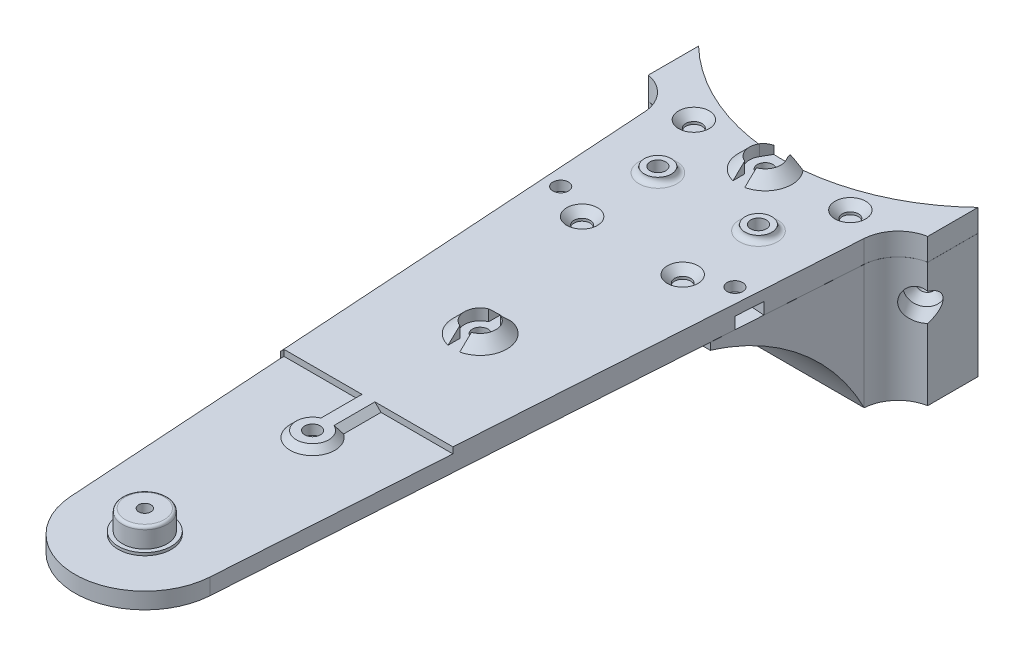
from build123d import *

# Parameters (mm, degrees)
BOSS_EXTRUDE1_DEPTH                            = 4
BOSS_EXTRUDE2_DEPTH                            = 22.2378
FILLET2_R                                      = 40
CUT_EXTRUDE3_DEPTH                             = 1.09
CUT_EXTRUDE4_DEPTH                             = 166.90892004
SKETCH11_R                                     = 161
CUT_EXTRUDE5_DEPTH                             = 0.01
SKETCH12_R                                     = 1.4
CUT_EXTRUDE6_DEPTH                             = 8.25
CUT_EXTRUDE7_DEPTH                             = 8.5
CUT_EXTRUDE8_DEPTH                             = 2.5
CSK_FOR_M2_5_FLAT_HEAD_MACHINE_SCREW3_AT_COUNT = 2
CSK_FOR_M2_5_FLAT_HEAD_MACHINE_SCREW3_AT_PITCH = 28
CSK_FOR_M2_5_FLAT_HEAD_MACHINE_SCREW_2_COUNT   = 2
CSK_FOR_M2_5_FLAT_HEAD_MACHINE_SCREW_2_PITCH   = 33.970575503
CSK_FOR_M2_5_FLAT_HEAD_MACHINE_SCREW_3_COUNT   = 2
CSK_FOR_M2_5_FLAT_HEAD_MACHINE_SCREW_3_PITCH   = 25.495097568
SKETCH18_R                                     = 1.4
CUT_EXTRUDE9_DEPTH                             = 166.90892004
CUT_EXTRUDE10_DEPTH                            = 2.1
SKETCH20_R                                     = 4.75
BOSS_EXTRUDE3_DEPTH                            = 0.5
SKETCH21_R                                     = 4
BOSS_EXTRUDE4_DEPTH                            = 3.5
FILLET4_R                                      = 0.5
SKETCH22_R                                     = 1.4
CUT_EXTRUDE12_DEPTH                            = 167.492258525
SKETCH24_R                                     = 1.1
CUT_EXTRUDE13_DEPTH                            = 167.975579786
SKETCH25_W                                     = 4
SKETCH25_H                                     = 3
BOSS_EXTRUDE6_DEPTH                            = 3
CHAMFER2_SIZE                                  = 1.8
CHAMFER4_SIZE                                  = 1.25
BOSS_EXTRUDE8_DEPTH                            = 2
CHAMFER5_SIZE                                  = 2
SKETCH31_R                                     = 2.75
CUT_EXTRUDE14_DEPTH                            = 10
CUT_EXTRUDE15_DEPTH                            = 2
SKETCH37_R                                     = 1.1
SACRIFICIAL_LAYER_DEPTH                        = 0.15
SKETCH38_R                                     = 2.309401077
BOSS_EXTRUDE9_DEPTH                            = 0.15
SKETCH39_R                                     = 2.4
SKETCH39_R_2                                   = 1.4
BOSS_EXTRUDE10_DEPTH                           = 1
FILLET5_R                                      = 1


# Some blends are built 0.0001 mm under size
with BuildPart() as part:
    # Sketch1 → Boss-Extrude1 (new body)
    with BuildSketch(Plane(origin=(0, 0, 0), x_dir=(1, 0, 0), z_dir=(0, 1, 0))):
        with BuildLine():
            Line((-12.473565799, -150.8125), (-19.632779747, -40.903667694))
            ThreePointArc((-19.632779747, -40.903667694), (-21.280860205, -36.977348392), (-25, -34.903667694))
            Line((-25, -34.903667694), (-25, -25.903667694))
            ThreePointArc((-25, -25.903667694), (0, -36), (25, -25.903667694))
            Line((25, -25.903667694), (25, -34.903667694))
            ThreePointArc((25, -34.903667694), (21.280860205, -36.977348392), (19.632779747, -40.903667694))
            Line((19.632779747, -40.903667694), (12.473565799, -150.8125))
            ThreePointArc((12.473565799, -150.8125), (0, -162.5), (-12.473565799, -150.8125))
        make_face()
    extrude(amount=-BOSS_EXTRUDE1_DEPTH)

    # Sketch2 → Boss-Extrude2 (add)
    with BuildSketch(Plane.XZ.offset(4)):
        with BuildLine():
            Line((25, 34.903667694), (25, 25.903667694))
            ThreePointArc((25, 25.903667694), (0, 36), (-25, 25.903667694))
            Line((-25, 25.903667694), (-25, 34.903667694))
            ThreePointArc((-25, 34.903667694), (-21.280860205, 36.977348392), (-19.632779747, 40.903667694))
            Line((-19.632779747, 40.903667694), (19.632779747, 40.903667694))
            ThreePointArc((19.632779747, 40.903667694), (21.280860205, 36.977348392), (25, 34.903667694))
        make_face()
    extrude(amount=BOSS_EXTRUDE2_DEPTH)

    # Fillet2
    # the kernel refuses this fillet: 40 mm, written as the material it adds along each edge
    with BuildSketch(Plane(origin=(-109.232732703, -4, 40.903667694), x_dir=(0, 0, 1), z_dir=(1, 0, 0))) as fillet2_piece_1_section:
        with BuildLine():
            CenterArc((35.839981182, 40), FILLET2_R, 206.362893779, 63.637106221)
            Line((0, 22.2378), (0, 0))
            Line((0, 0), (35.839981182, 0))
        make_face()
    fillet2_piece_1 = extrude(amount=218.465465407, mode=Mode.PRIVATE)
    fillet2_piece_1 = split(fillet2_piece_1, bisect_by=Plane(origin=(18.595796417, -9.943141704, 56.823519759), z_dir=(-0.9978852639457103, 0, -0.06499999999999989)), keep=Keep.TOP, mode=Mode.PRIVATE)
    fillet2_piece_1 = split(fillet2_piece_1, bisect_by=Plane(origin=(-18.595796417, -9.943141704, 56.823519759), z_dir=(0.9978852639457103, 0, -0.06500000000000017)), keep=Keep.TOP, mode=Mode.PRIVATE)
    add(fillet2_piece_1)

    # Sketch8 → Cut-Extrude3 (cut)
    with BuildSketch(Plane(origin=(0, 0, 0), x_dir=(1, 0, 0), z_dir=(0, 1, 0))):
        with BuildLine():
            Line((15.132175098, -109.997314749), (15.132175098, -176.632383444))
            Line((15.132175098, -176.632383444), (-15.089558856, -176.632383444))
            Line((-15.089558856, -176.632383444), (-15.089558856, -109.997314749))
            Line((-15.089558856, -109.997314749), (-0.980468048, -109.997314749))
            Line((-0.980468048, -109.997314749), (-0.979146745, -117.438438025))
            ThreePointArc((-0.979146745, -117.438438025), (0.021796432, -122.749998065), (1.020853223, -117.438082889))
            Line((1.020853223, -117.438082889), (1.019531983, -109.997314749))
            Line((1.019531983, -109.997314749), (15.132175098, -109.997314749))
        make_face()
    extrude(amount=-CUT_EXTRUDE3_DEPTH, mode=Mode.SUBTRACT)

    # Sketch9 → Cut-Extrude4 (cut, through all)
    with BuildSketch(Plane.XZ.offset(4)):
        Polygon((-17.298244043, 76.743648876), (17.298244043, 76.743648876), (17.949621535, 66.743648876), (-17.949621535, 66.743648876), align=None)
    extrude(amount=CUT_EXTRUDE4_DEPTH, mode=Mode.SUBTRACT)

    # Sketch11 → Cut-Extrude5 (cut)
    with BuildSketch(Plane.XZ.offset(4)):
        Circle(SKETCH11_R)
    extrude(amount=CUT_EXTRUDE5_DEPTH, mode=Mode.SUBTRACT)


with BuildPart() as cut_extrude5_piece_1:
    # of the separate pieces the step leaves, piece 1, a body of its own (cut_extrude5_pieces)
    add(part.part.solids().sort_by_distance((-19.632779747, -26.2378, 40.903667694))[0])


with BuildPart() as cut_extrude5_piece_2:
    # of the separate pieces the step leaves, piece 2, a body of its own (cut_extrude5_pieces)
    add(part.part.solids().sort_by_distance((-19.632779747, -4, 40.903667694))[0])


with BuildPart() as cut_extrude6_tool:
    # Sketch12 → Cut-Extrude6 (new body)
    with BuildSketch(Plane(origin=(0, 0, 0), x_dir=(1, 0, 0), z_dir=(0, 1, 0))):
        with Locations(Location((-14, -37.743648876, 0), (0, 0, 270))):
            Circle(SKETCH12_R)
        with Locations(Location((14, -37.743648876, 0), (0, 0, 270))):
            Circle(SKETCH12_R)
        with Locations(Location((-9, -62.743648876, 0), (0, 0, 270))):
            Circle(SKETCH12_R)
        with Locations(Location((9, -62.743648876, 0), (0, 0, 270))):
            Circle(SKETCH12_R)
    extrude(amount=-CUT_EXTRUDE6_DEPTH)


with BuildPart() as cut_extrude5_piece_1_1:
    add(cut_extrude5_piece_1.part)

    # Cut-Extrude6: cut by cut_extrude6_tool
    add(cut_extrude6_tool.part, mode=Mode.SUBTRACT)

    # Sketch13 → Cut-Extrude7 (cut)
    with BuildSketch(Plane(origin=(0, -5.270166538, 0), x_dir=(1, 0, 0), z_dir=(0, 1, 0))):
        Polygon((-11.45, -64.158157036), (-11.45, -66.743648876), (-6.55, -66.743648876), (-6.55, -64.158157036), (-6.55, -61.329140717), (-9, -59.914632557), (-11.45, -61.329140717), align=None)
        Polygon((11.45, -66.743648876), (6.55, -66.743648876), (6.55, -64.158157036), (6.55, -61.329140717), (9, -59.914632557), (11.45, -61.329140717), (11.45, -64.158157036), align=None)
    extrude(amount=-CUT_EXTRUDE7_DEPTH, mode=Mode.SUBTRACT)

    # Sketch14 → Cut-Extrude8 (cut)
    with BuildSketch(Plane(origin=(0, -8.25, 0), x_dir=(1, 0, 0), z_dir=(0, 1, 0))):
        Polygon((-15.805146683, -35.565397562), (-14.787771904, -32.822580674), (-10.193630906, -34.526654761), (-11.211005685, -37.269471649), (-12.194853317, -39.92190019), (-14.983847632, -40.396077418), (-16.788994315, -38.217826104), align=None)
        Polygon((14.787771904, -32.822580674), (10.193630906, -34.526654761), (11.211005685, -37.269471649), (12.194853317, -39.92190019), (14.983847632, -40.396077418), (16.788994315, -38.217826104), (15.805146683, -35.565397562), align=None)
    extrude(amount=CUT_EXTRUDE8_DEPTH, mode=Mode.SUBTRACT)


with BuildPart() as cut_extrude5_piece_2_1:
    add(cut_extrude5_piece_2.part)

    # Cut-Extrude6: cut by cut_extrude6_tool
    add(cut_extrude6_tool.part, mode=Mode.SUBTRACT)


with BuildPart() as csk_for_m2_5_flat_head_machine_screw3_tool:
    # Sketch16 → CSK for M2.5 Flat Head Machine Screw3 (revolve)
    with BuildSketch(Plane(origin=(-14, 0, 37.743648876), x_dir=(0, 0, 1), z_dir=(1, 0, 0))):
        Polygon((0, 0), (0, 7.871247898), (1.45, 7), (1.45, 1.3), (2.75, 0), align=None)
    csk_for_m2_5_flat_head_machine_screw3 = revolve(axis=Axis((-14, 6.35, 37.743648876), (0, -1, 0)))


with BuildPart() as cut_extrude5_piece_1_2:
    add(cut_extrude5_piece_1_1.part)

    # CSK for M2.5 Flat Head Machine Screw3: cut by csk_for_m2_5_flat_head_machine_screw3_tool
    add(csk_for_m2_5_flat_head_machine_screw3_tool.part, mode=Mode.SUBTRACT)


with BuildPart() as cut_extrude5_piece_2_2:
    add(cut_extrude5_piece_2_1.part)

    # CSK for M2.5 Flat Head Machine Screw3: cut by csk_for_m2_5_flat_head_machine_screw3_tool
    add(csk_for_m2_5_flat_head_machine_screw3_tool.part, mode=Mode.SUBTRACT)


with BuildPart() as csk_for_m2_5_flat_head_machine_screw3_at_tool:
    # CSK for M2.5 Flat Head Machine Screw3 at: CSK for M2.5 Flat Head Machine Screw3 ×2
    with Locations(*[(i * CSK_FOR_M2_5_FLAT_HEAD_MACHINE_SCREW3_AT_PITCH, 0, 0) for i in range(1, CSK_FOR_M2_5_FLAT_HEAD_MACHINE_SCREW3_AT_COUNT)]):
        add(csk_for_m2_5_flat_head_machine_screw3)


with BuildPart() as cut_extrude5_piece_1_3:
    add(cut_extrude5_piece_1_2.part)

    # CSK for M2.5 Flat Head Machine Screw3 at: cut by csk_for_m2_5_flat_head_machine_screw3_at_tool
    add(csk_for_m2_5_flat_head_machine_screw3_at_tool.part, mode=Mode.SUBTRACT)


with BuildPart() as cut_extrude5_piece_2_3:
    add(cut_extrude5_piece_2_2.part)

    # CSK for M2.5 Flat Head Machine Screw3 at: cut by csk_for_m2_5_flat_head_machine_screw3_at_tool
    add(csk_for_m2_5_flat_head_machine_screw3_at_tool.part, mode=Mode.SUBTRACT)


with BuildPart() as csk_for_m2_5_flat_head_machine_screw_2_tool:
    # CSK for M2.5 Flat Head Machine Screw 2: CSK for M2.5 Flat Head Machine Screw3 ×2
    with Locations(*[Vector(0.6770565308208834, 0, 0.7359310117618297) * (i * CSK_FOR_M2_5_FLAT_HEAD_MACHINE_SCREW_2_PITCH) for i in range(1, CSK_FOR_M2_5_FLAT_HEAD_MACHINE_SCREW_2_COUNT)]):
        add(csk_for_m2_5_flat_head_machine_screw3)


with BuildPart() as cut_extrude5_piece_1_4:
    add(cut_extrude5_piece_1_3.part)

    # CSK for M2.5 Flat Head Machine Screw 2: cut by csk_for_m2_5_flat_head_machine_screw_2_tool
    add(csk_for_m2_5_flat_head_machine_screw_2_tool.part, mode=Mode.SUBTRACT)


with BuildPart() as cut_extrude5_piece_2_4:
    add(cut_extrude5_piece_2_3.part)

    # CSK for M2.5 Flat Head Machine Screw 2: cut by csk_for_m2_5_flat_head_machine_screw_2_tool
    add(csk_for_m2_5_flat_head_machine_screw_2_tool.part, mode=Mode.SUBTRACT)


with BuildPart() as csk_for_m2_5_flat_head_machine_screw_3_tool:
    # CSK for M2.5 Flat Head Machine Screw 3: CSK for M2.5 Flat Head Machine Screw3 ×2
    with Locations(*[Vector(0.19611613513818407, 0, 0.9805806756909202) * (i * CSK_FOR_M2_5_FLAT_HEAD_MACHINE_SCREW_3_PITCH) for i in range(1, CSK_FOR_M2_5_FLAT_HEAD_MACHINE_SCREW_3_COUNT)]):
        add(csk_for_m2_5_flat_head_machine_screw3)


with BuildPart() as cut_extrude5_piece_1_5:
    add(cut_extrude5_piece_1_4.part)

    # CSK for M2.5 Flat Head Machine Screw 3: cut by csk_for_m2_5_flat_head_machine_screw_3_tool
    add(csk_for_m2_5_flat_head_machine_screw_3_tool.part, mode=Mode.SUBTRACT)

    # Sketch25 → Boss-Extrude6 (add)
    with BuildSketch(Plane(origin=(0, 0, 36), x_dir=(-1, 0, 0), z_dir=(0, 0, -1))):
        with Locations((-12.13, -17.5)):
            Rectangle(SKETCH25_W, SKETCH25_H)
        with Locations((12.13, -17.5)):
            Rectangle(SKETCH25_W, SKETCH25_H)
    extrude(amount=BOSS_EXTRUDE6_DEPTH)

    # Chamfer2
    # the kernel refuses this chamfer: 1.8 mm, written as the material it adds along each edge
    with BuildSketch(Plane(origin=(0, -19, 0), x_dir=(-0.5071998456341332, 0, 0.8618284728347696), z_dir=(-0.8618284728347696, 0, -0.5071998456341332))) as chamfer2_piece_1_section:
        Polygon((36, -CHAMFER2_SIZE), (36 - CHAMFER2_SIZE, 0), (36, 0), align=None)
    chamfer2_piece_1 = revolve(axis=Axis((0, -19, 0), (0, 1, 0)), revolution_arc=21.501722573, mode=Mode.PRIVATE)
    chamfer2_piece_1 = split(chamfer2_piece_1, bisect_by=Plane(origin=(-10.13, -19.704712523, 33.608843725), z_dir=(-1, 0, 0)), keep=Keep.TOP, mode=Mode.PRIVATE)
    chamfer2_piece_1 = split(chamfer2_piece_1, bisect_by=Plane(origin=(-14.13, -19.704712523, 33.608843725), z_dir=(1, 0, 0)), keep=Keep.TOP, mode=Mode.PRIVATE)
    chamfer2_piece_1 = split(chamfer2_piece_1, bisect_by=Plane(origin=(-11.739841484, -19.704712523, 33), z_dir=(0, 0, 1)), keep=Keep.TOP, mode=Mode.PRIVATE)
    add(chamfer2_piece_1)
    with BuildSketch(Plane(origin=(0, -19, 0), x_dir=(0.15601675799383805, 0, 0.9877544083551802), z_dir=(-0.9877544083551802, 0, 0.15601675799383805))) as chamfer2_piece_2_section:
        Polygon((36, -CHAMFER2_SIZE), (36 - CHAMFER2_SIZE, 0), (36, 0), align=None)
    chamfer2_piece_2 = revolve(axis=Axis((0, -19, 0), (0, 1, 0)), revolution_arc=21.501722573, mode=Mode.PRIVATE)
    chamfer2_piece_2 = split(chamfer2_piece_2, bisect_by=Plane(origin=(10.13, -19.704712522, 33.608843721), z_dir=(1, 0, 0)), keep=Keep.TOP, mode=Mode.PRIVATE)
    chamfer2_piece_2 = split(chamfer2_piece_2, bisect_by=Plane(origin=(14.13, -19.704712522, 33.608843721), z_dir=(-1, 0, 0)), keep=Keep.TOP, mode=Mode.PRIVATE)
    chamfer2_piece_2 = split(chamfer2_piece_2, bisect_by=Plane(origin=(11.739841483, -19.704712522, 33), z_dir=(0, 0, 1)), keep=Keep.TOP, mode=Mode.PRIVATE)
    add(chamfer2_piece_2)

    # Sketch31 → Cut-Extrude14 (cut)
    with BuildSketch(Plane(origin=(-21.808523235, 0, 32.33246533), x_dir=(-0.8290375725550408, 0, -0.5591929034707482), z_dir=(0.5591929034707482, 0, -0.8290375725550408))):
        with Locations((0, -11)):
            Circle(SKETCH31_R)
    cut_extrude14 = extrude(amount=-CUT_EXTRUDE14_DEPTH, mode=Mode.SUBTRACT)

    # Sketch33 → CSK for M2.5 Flat Head Machine Screw2 (revolve, cut)
    with BuildSketch(Plane(origin=(-21.808523235, -11, 32.33246533), x_dir=(0.8290375725550407, 0, 0.5591929034707483), z_dir=(0, 1, 0))):
        Polygon((0, 0), (0, 31.602709864), (1.45, 31.602709864), (1.45, 1.3), (2.75, 0), align=None)
    csk_for_m2_5_flat_head_machine_screw2 = revolve(axis=Axis((-25.359398172, -11, 37.596853915), (0.5591929034707483, 0, -0.8290375725550406)), mode=Mode.SUBTRACT)

    # Mirror1: Cut-Extrude14, CSK for M2.5 Flat Head Machine Screw2 across plane
    add(cut_extrude14.mirror(Plane(origin=(0, 0, 0), x_dir=(0, 0, 1), z_dir=(1, 0, 0))), mode=Mode.SUBTRACT)
    add(csk_for_m2_5_flat_head_machine_screw2.mirror(Plane(origin=(0, 0, 0), x_dir=(0, 0, 1), z_dir=(1, 0, 0))), mode=Mode.SUBTRACT)


with BuildPart() as cut_extrude5_piece_2_5:
    add(cut_extrude5_piece_2_4.part)

    # CSK for M2.5 Flat Head Machine Screw 3: cut by csk_for_m2_5_flat_head_machine_screw_3_tool
    add(csk_for_m2_5_flat_head_machine_screw_3_tool.part, mode=Mode.SUBTRACT)

    # Sketch18 → Cut-Extrude9 (cut, through all)
    with BuildSketch(Plane.XZ.offset(4)):
        with Locations(Location((-15.572477607, 60.002851318, 0), (0, 0, 270))):
            Circle(SKETCH18_R)
        with Locations(Location((15.594441842, 59.997146672, 0), (0, 0, 270))):
            Circle(SKETCH18_R)
        with Locations(Location((0.007138377, 38.999999347, 0), (0, 0, 270))):
            Circle(SKETCH18_R)
        with Locations(Location((0.021308121, 119.999998108, 0), (0, 0, 270))):
            Circle(SKETCH18_R)
        with Locations(Location((0.015981091, 89.999998581, 0), (0, 0, 270))):
            Circle(SKETCH18_R)
    extrude(amount=-CUT_EXTRUDE9_DEPTH, mode=Mode.SUBTRACT)

    # Sketch19 → Cut-Extrude10 (cut)
    with BuildSketch(Plane.XZ.offset(4)):
        Polygon((1.43581628, 122.449998108), (-1.393200039, 122.449998108), (-2.807708198, 119.999998108), (-1.393200039, 117.549998108), (1.43581628, 117.549998108), (2.85032444, 119.999998108), align=None)
        Polygon((1.43048925, 92.449998581), (-1.398527069, 92.449998581), (-2.813035228, 89.999998581), (-1.398527069, 87.549998581), (1.43048925, 87.549998581), (2.84499741, 89.999998581), align=None)
        Polygon((-12.749443911, 59.818965257), (-14.001710759, 62.355727184), (-16.824744455, 62.539613245), (-18.217553368, 62.630337683), (-18.536053368, 57.740699889), (-17.143244455, 57.649975452), (-14.320210759, 57.466089391), align=None)
        Polygon((2.453561389, 37.579313675), (2.460699765, 40.408320988), (0.014276753, 41.82900666), (-2.439284636, 40.420685019), (-2.446423012, 37.591677706), (-2.446423012, 35.91677901), (2.453561389, 35.916292076), align=None)
        Polygon((18.217553368, 62.630337683), (18.536053368, 57.740699889), (17.143244455, 57.649975452), (14.320210759, 57.466089391), (12.749443911, 59.818965257), (14.001710759, 62.355727184), (16.824744455, 62.539613245), align=None)
    extrude(amount=-CUT_EXTRUDE10_DEPTH, mode=Mode.SUBTRACT)

    # Sketch20 → Boss-Extrude3 (add)
    with BuildSketch(Plane(origin=(0, -1.09, 0), x_dir=(1, 0, 0), z_dir=(0, 1, 0))):
        with Locations(Location((0, -150, 0), (0, 0, 270))):
            Circle(SKETCH20_R)
    extrude(amount=BOSS_EXTRUDE3_DEPTH)

    # Sketch21 → Boss-Extrude4 (add)
    with BuildSketch(Plane(origin=(0, -0.59, 0), x_dir=(1, 0, 0), z_dir=(0, 1, 0))):
        with Locations(Location((0, -150, 0), (0, 0, 270))):
            Circle(SKETCH21_R)
    extrude(amount=BOSS_EXTRUDE4_DEPTH)

    # Fillet4
    fillet4_edges = [cut_extrude5_piece_2_5.edges().sort_by_distance(p)[0] for p in [
        (0, 2.91, 146),
    ]]
    fillet(fillet4_edges, radius=FILLET4_R)

    # Sketch22 → Cut-Extrude12 (cut, through all)
    with BuildSketch(Plane(origin=(0, 0, 0), x_dir=(1, 0, 0), z_dir=(0, 1, 0))):
        with Locations(Location((9, -49.183330509, 0), (0, 0, 270))):
            Circle(SKETCH22_R)
        with Locations(Location((-9, -49.183330509, 0), (0, 0, 270))):
            Circle(SKETCH22_R)
    extrude(amount=-CUT_EXTRUDE12_DEPTH, mode=Mode.SUBTRACT)

    # Sketch24 → Cut-Extrude13 (cut, through all)
    with BuildSketch(Plane.XZ.offset(-2.91)):
        with Locations(Location((0, 150, 0), (0, 0, 90))):
            Circle(SKETCH24_R)
    extrude(amount=CUT_EXTRUDE13_DEPTH, mode=Mode.SUBTRACT)

    # Chamfer4
    # the kernel refuses this chamfer: 1.25 mm, written as the material it adds along each edge
    with BuildSketch(Plane(origin=(0.021308121, -1.09, 119.999998108), x_dir=(-0.003319154233992222, 0, -0.9999944915924143), z_dir=(0.9999944915924143, 0, -0.003319154233992222))) as chamfer4_piece_1_section:
        Polygon((2.75 + CHAMFER4_SIZE, 0), (2.75, CHAMFER4_SIZE), (2.75, 0), align=None)
    chamfer4_piece_1 = revolve(axis=Axis((0.021308121, -1.09, 119.999998108), (0, 1, 0)), revolution_arc=359.64, mode=Mode.PRIVATE)
    chamfer4_piece_1 = split(chamfer4_piece_1, bisect_by=Plane(origin=(-3.420775264, 0, 120.000609311), z_dir=(0, -1, 0)), keep=Keep.TOP, mode=Mode.PRIVATE)
    add(chamfer4_piece_1)
    with BuildSketch(Plane(origin=(-0.981038858, -1.09, 106.782711065), x_dir=(-0.9996219011521176, -0.027495876610586313, 0.00017750053856955747), z_dir=(0.00017756767390416105, 0, 0.9999999842348605))) as chamfer4_piece_2_section:
        Polygon((CHAMFER4_SIZE * 0.999621916911, -CHAMFER4_SIZE * 0.0274958766106), (-CHAMFER4_SIZE * 0.0274958766106, -CHAMFER4_SIZE * 0.999621916911), (0, 0), align=None)
    chamfer4_piece_2 = extrude(amount=13.870330863, mode=Mode.PRIVATE)
    chamfer4_piece_2 = split(chamfer4_piece_2, bisect_by=Plane(origin=(-1.41003303, 0, 113.838117962), z_dir=(0, -1, 0)), keep=Keep.TOP, mode=Mode.PRIVATE)
    chamfer4_piece_2 = chamfer4_piece_2 - Plane(origin=(0.021308121, -0.688949021, 119.999998108), x_dir=(0, 0, -1), z_dir=(0, -1, 0)) * Cylinder(1.4, 33, mode=Mode.PRIVATE)
    add(chamfer4_piece_2)
    with BuildSketch(Plane(origin=(1.021424033, -1.09, 120.652686574), x_dir=(0.9996219011521178, -0.027495876610586313, -0.000177500538569537), z_dir=(-0.00017756767390414056, 0, -0.9999999842348606))) as chamfer4_piece_3_section:
        Polygon((CHAMFER4_SIZE * 0.999621916911, -CHAMFER4_SIZE * 0.0274958766106), (-CHAMFER4_SIZE * 0.0274958766106, -CHAMFER4_SIZE * 0.999621916911), (0, 0), align=None)
    chamfer4_piece_3 = extrude(amount=13.869975728, mode=Mode.PRIVATE)
    chamfer4_piece_3 = split(chamfer4_piece_3, bisect_by=Plane(origin=(1.450457441, 0, 113.837862813), z_dir=(0, -1, 0)), keep=Keep.TOP, mode=Mode.PRIVATE)
    chamfer4_piece_3 = chamfer4_piece_3 - Plane(origin=(0.021308121, -0.688947419, 119.999998108), x_dir=(0, 0, -1), z_dir=(0, -1, 0)) * Cylinder(1.4, 33, mode=Mode.PRIVATE)
    add(chamfer4_piece_3)

    # Sketch29 → Boss-Extrude8 (add)
    with BuildSketch(Plane(origin=(0, 0, 0), x_dir=(1, 0, 0), z_dir=(0, 1, 0))):
        with BuildLine():
            ThreePointArc((-1.05, -41.592769767), (-2.641757895, -39.907384899), (-2.417732754, -37.599999347))
            Line((-2.417732754, -37.599999347), (-1.47648441, -35.969709393))
            ThreePointArc((-1.47648441, -35.969709393), (-2.533808843, -35.910720025), (-3.588940799, -35.820657503))
            ThreePointArc((-3.588940799, -35.820657503), (-4.560557153, -40.475179862), (-1.05, -43.682141853))
            Line((-1.05, -43.682141853), (-1.05, -41.592769767))
        make_face()
        with BuildLine():
            Line((1.491860951, -35.969074924), (2.432009507, -37.599999347))
            ThreePointArc((2.432009507, -37.599999347), (2.65352922, -39.914666228), (1.05, -41.598545023))
            Line((1.05, -41.598545023), (1.05, -43.685342411))
            ThreePointArc((1.05, -43.685342411), (4.572851525, -40.481303991), (3.602053448, -35.819341297))
            ThreePointArc((3.602053448, -35.819341297), (2.548057302, -35.909711834), (1.491860951, -35.969074924))
        make_face()
        with BuildLine():
            Line((-1.05, -87.41085117), (-1.05, -85.31986137))
            ThreePointArc((-1.05, -85.31986137), (-4.784018909, -89.999998581), (-1.05, -94.680135792))
            Line((-1.05, -94.680135792), (-1.05, -92.589145992))
            ThreePointArc((-1.05, -92.589145992), (-2.784018909, -89.999998581), (-1.05, -87.41085117))
        make_face()
        with BuildLine():
            ThreePointArc((1.05, -94.687301099), (4.815981091, -89.999998581), (1.05, -85.312696063))
            Line((1.05, -85.312696063), (1.05, -87.397921546))
            ThreePointArc((1.05, -87.397921546), (2.815981091, -89.999998581), (1.05, -92.602075616))
            Line((1.05, -92.602075616), (1.05, -94.687301099))
        make_face()
    extrude(amount=BOSS_EXTRUDE8_DEPTH)

    # Chamfer5
    # the kernel refuses this chamfer: 2 mm, written as the material it takes off along each edge
    with BuildSketch(Plane(origin=(0.015981091, 2, 89.999998581), x_dir=(0.7505238989331617, 0, -0.6608433075473832), z_dir=(0.6608433075473832, 0, 0.7505238989331617))) as chamfer5_piece_1_section:
        Polygon((4.8, -CHAMFER5_SIZE), (4.8 - CHAMFER5_SIZE, 0), (4.8, 0), align=None)
    chamfer5_piece_1 = revolve(axis=Axis((0.015981091, 2, 89.999998581), (0, 1, 0)), revolution_arc=277.27156006, mode=Mode.PRIVATE)
    chamfer5_piece_1 = split(chamfer5_piece_1, bisect_by=Plane(origin=(-3.780700028, 0, 89.999998581), z_dir=(0, 1, 0)), keep=Keep.TOP, mode=Mode.PRIVATE)
    add(chamfer5_piece_1, mode=Mode.SUBTRACT)
    with BuildSketch(Plane(origin=(0.007138377, 2, 38.999999347), x_dir=(-0.7534392820015536, 0, 0.6575174889970482), z_dir=(-0.6575174889970482, 0, -0.7534392820015536))) as chamfer5_piece_2_section:
        Polygon((4.8, -CHAMFER5_SIZE), (4.8 - CHAMFER5_SIZE, 0), (4.8, 0), align=None)
    chamfer5_piece_2 = revolve(axis=Axis((0.007138377, 2, 38.999999347), (0, 1, 0)), revolution_arc=241.827988832, mode=Mode.PRIVATE)
    chamfer5_piece_2 = split(chamfer5_piece_2, bisect_by=Plane(origin=(3.617446082, 0, 40.171331272), z_dir=(0, 1, 0)), keep=Keep.TOP, mode=Mode.PRIVATE)
    add(chamfer5_piece_2, mode=Mode.SUBTRACT)
    with BuildSketch(Plane(origin=(0.007138377, 2, 38.999999347), x_dir=(0.22355104352578267, 0, -0.9746922236986061), z_dir=(0.9746922236986061, 0, 0.22355104352578267))) as chamfer5_piece_3_section:
        Polygon((4.8, -CHAMFER5_SIZE), (4.8 - CHAMFER5_SIZE, 0), (4.8, 0), align=None)
    chamfer5_piece_3 = revolve(axis=Axis((0.007138377, 2, 38.999999347), (0, 1, 0)), revolution_arc=241.632085139, mode=Mode.PRIVATE)
    chamfer5_piece_3 = split(chamfer5_piece_3, bisect_by=Plane(origin=(-3.604730752, 0, 40.166486677), z_dir=(0, 1, 0)), keep=Keep.TOP, mode=Mode.PRIVATE)
    add(chamfer5_piece_3, mode=Mode.SUBTRACT)
    with BuildSketch(Plane(origin=(0.015981091, 2, 89.999998581), x_dir=(-0.7550244770640718, 0, 0.6556966059345776), z_dir=(-0.6556966059345776, 0, -0.7550244770640718))) as chamfer5_piece_4_section:
        Polygon((4.8, -CHAMFER5_SIZE), (4.8 - CHAMFER5_SIZE, 0), (4.8, 0), align=None)
    chamfer5_piece_4 = revolve(axis=Axis((0.015981091, 2, 89.999998581), (0, 1, 0)), revolution_arc=278.055017136, mode=Mode.PRIVATE)
    chamfer5_piece_4 = split(chamfer5_piece_4, bisect_by=Plane(origin=(3.812685701, 0, 89.999998581), z_dir=(0, 1, 0)), keep=Keep.TOP, mode=Mode.PRIVATE)
    add(chamfer5_piece_4, mode=Mode.SUBTRACT)

    # Sketch35 → Cut-Extrude15 (cut)
    with BuildSketch(Plane.XZ.offset(4)):
        Polygon((2.309401077, 150), (1.154700538, 152), (-1.154700538, 152), (-2.309401077, 150), (-1.154700538, 148), (1.154700538, 148), align=None)
    extrude(amount=-CUT_EXTRUDE15_DEPTH, mode=Mode.SUBTRACT)

    # Sketch37 → sacrificial layer (add)
    with BuildSketch(Plane.XZ.offset(1.9)):
        with BuildLine():
            Line((-18.217553368, 62.630337683), (-18.536053368, 57.740699889))
            Line((-18.536053368, 57.740699889), (-19.632779747, 40.903667694))
            ThreePointArc((-19.632779747, 40.903667694), (-21.280860205, 36.977348392), (-25, 34.903667694))
            Line((-25, 34.903667694), (-25, 25.903667694))
            ThreePointArc((-25, 25.903667694), (-14.607947618, 32.903006951), (-2.446423012, 35.91677901))
            Line((-2.446423012, 35.91677901), (2.453561389, 35.916292076))
            ThreePointArc((2.453561389, 35.916292076), (14.611217266, 32.901555131), (25, 25.903667694))
            Line((25, 25.903667694), (25, 34.903667694))
            ThreePointArc((25, 34.903667694), (21.280860205, 36.977348392), (19.632779747, 40.903667694))
            Line((19.632779747, 40.903667694), (18.536053368, 57.740699889))
            Line((18.536053368, 57.740699889), (18.217553368, 62.630337683))
            Line((18.217553368, 62.630337683), (12.473565799, 150.8125))
            ThreePointArc((12.473565799, 150.8125), (0, 162.5), (-12.473565799, 150.8125))
            Line((-12.473565799, 150.8125), (-18.217553368, 62.630337683))
        make_face()
        with Locations(Location((0, 150, 0), (0, 0, 270))):
            Circle(SKETCH37_R, mode=Mode.SUBTRACT)
    extrude(amount=-SACRIFICIAL_LAYER_DEPTH)

    # Sketch38 → Boss-Extrude9 (add)
    with BuildSketch(Plane.XZ.offset(2)):
        with Locations((0, 150)):
            Circle(SKETCH38_R)
    extrude(amount=-BOSS_EXTRUDE9_DEPTH)

    # Sketch39 → Boss-Extrude10 (add)
    # profile 1 of 2: a face of its own
    with BuildSketch(Plane(origin=(0, 0, 0), x_dir=(1, 0, 0), z_dir=(0, 1, 0))):
        with Locations(Location((9, -49.183330509, 0), (0, 0, 270))):
            Circle(SKETCH39_R)
        with Locations(Location((9, -49.183330509, 0), (0, 0, 270))):
            Circle(SKETCH39_R_2, mode=Mode.SUBTRACT)
    # profile 2 of 2: a face of its own
    with BuildSketch(Plane(origin=(0, 0, 0), x_dir=(1, 0, 0), z_dir=(0, 1, 0))):
        with Locations(Location((-9, -49.183330509, 0), (0, 0, 90))):
            Circle(SKETCH39_R)
        with Locations(Location((-9, -49.183330509, 0), (0, 0, 270))):
            Circle(SKETCH39_R_2, mode=Mode.SUBTRACT)
    extrude(amount=BOSS_EXTRUDE10_DEPTH)

    # Fillet5
    fillet5_edges = [cut_extrude5_piece_2_5.edges().sort_by_distance(p)[0] for p in [
        (9, 0, 46.783330509),
        (-9, 0, 51.583330509),
    ]]
    fillet(fillet5_edges, radius=FILLET5_R - 0.0001)  # a hair under: the kernel refuses the full size


solid = Compound([cut_extrude5_piece_1_5.part, cut_extrude5_piece_2_5.part])
